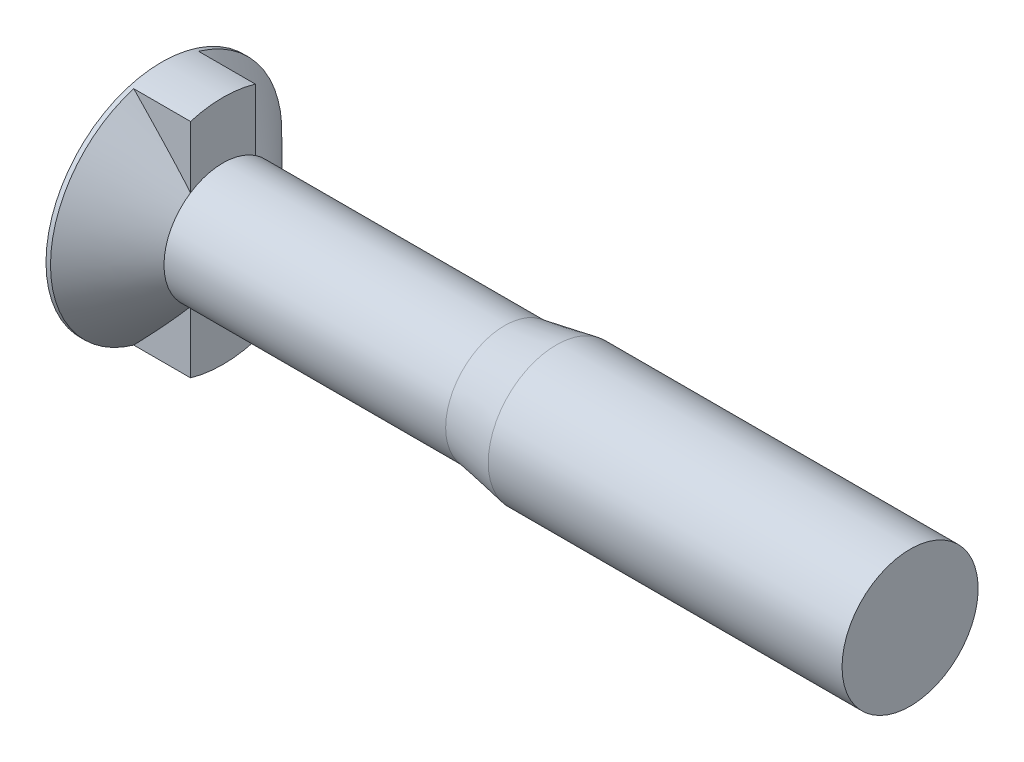
from build123d import *

# Parameters (mm, degrees)
SKETCH3_W          = 4.5
SKETCH3_H          = 17
NIB_DEPTH          = 2.38
SKETCH4_OUTSIDE_W  = 31.004
SKETCH4_OUTSIDE_H  = 31.004
SKETCH4_OUTSIDE_R  = 8.5
CUT_EXTRUDE1_DEPTH = 57.298312586


with BuildPart() as part:
    # Sketch2 → Base (revolve)
    with BuildSketch(Plane.XY):
        Polygon((0, 0), (0, 8.5), (0.329957473, 8.5), (4.5, 4.329957473), (25.2, 4.329957473), (29, 5), (55, 5), (55, 0), align=None)
    revolve(axis=Axis((-4.940548776, 0, 0), (1, 0, 0)))

    # Sketch3 → Nib (add, symmetric)
    with BuildSketch(Plane.XY):
        with Locations((2.25, 0)):
            Rectangle(SKETCH3_W, SKETCH3_H)
    extrude(amount=NIB_DEPTH, both=True)

    # Sketch4 outside → Cut-Extrude1 (cut, through all)
    with BuildSketch(Plane.ZY):
        Rectangle(SKETCH4_OUTSIDE_W, SKETCH4_OUTSIDE_H)
        Circle(SKETCH4_OUTSIDE_R, mode=Mode.SUBTRACT)
    extrude(amount=-CUT_EXTRUDE1_DEPTH, mode=Mode.SUBTRACT)


solid = part.part
